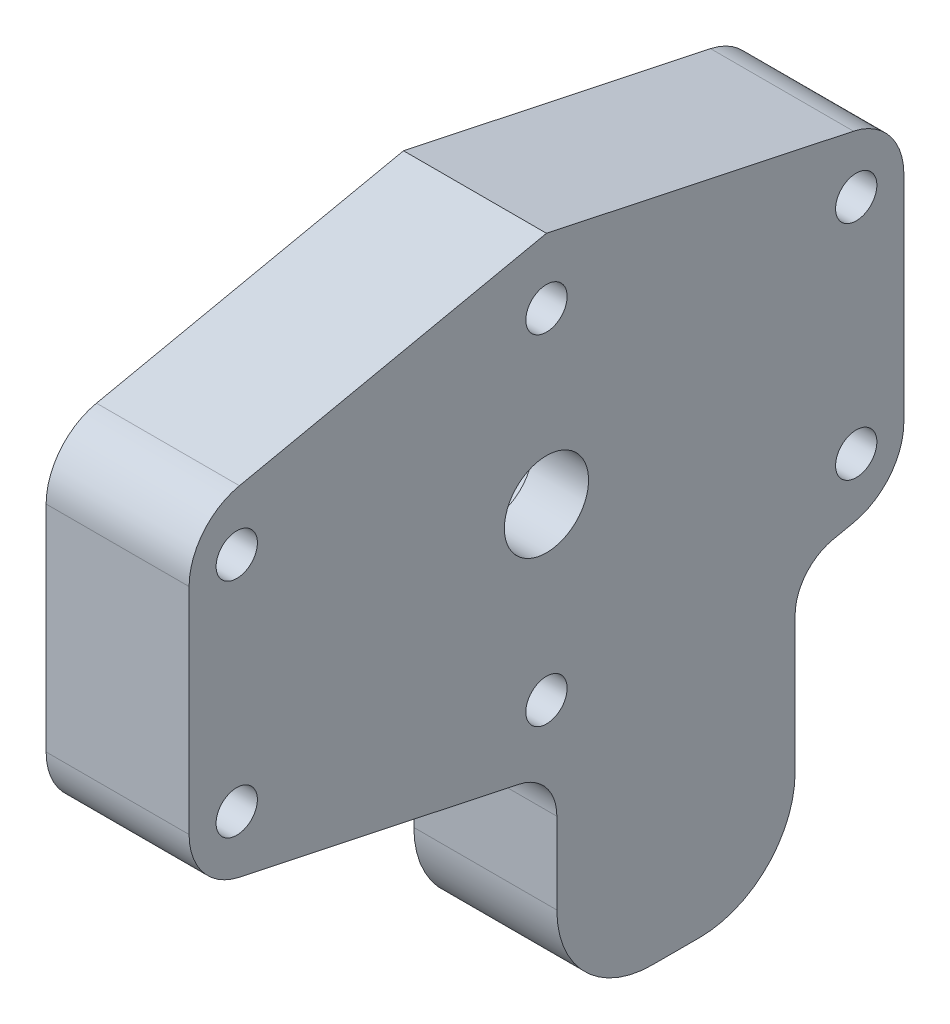
from build123d import *

# Parameters (mm, degrees)
SKETCH1_R           = 1.3
BOSS_EXTRUDE1_DEPTH = 9
CUT_REVOLVE3_ANGLE  = 180
SKETCH8_R           = 7.6
CUT_EXTRUDE4_DEPTH  = 5.5
SKETCH9_R           = 2.65
CUT_EXTRUDE5_DEPTH  = 52.660312042
BOSS_EXTRUDE7_DEPTH = 9
CUT_REVOLVE4_ANGLE  = 180
FILLET1_R           = 6
FILLET2_R           = 4
FILLET3_R           = 3
FILLET4_R           = 3


with BuildPart() as part:
    # Sketch1 → Boss-Extrude1 (new body)
    with BuildSketch(Plane(origin=(0, 0, 0), x_dir=(0, 0, -1), z_dir=(1, 0, 0))):
        Polygon((0, -20), (22.5, -24.769696007), (45, -20), (45, 0), (22.5, 4.769696007), (0, 0), align=None)
        with Locations((22.5, -20.680807118)):
            Circle(SKETCH1_R, mode=Mode.SUBTRACT)
        with Locations((22.5, 0.680807118)):
            Circle(SKETCH1_R, mode=Mode.SUBTRACT)
        with Locations((42, -17)):
            Circle(SKETCH1_R, mode=Mode.SUBTRACT)
        with Locations((3, -17)):
            Circle(SKETCH1_R, mode=Mode.SUBTRACT)
        with Locations((3, -3)):
            Circle(SKETCH1_R, mode=Mode.SUBTRACT)
        with Locations((42, -3)):
            Circle(SKETCH1_R, mode=Mode.SUBTRACT)
    extrude(amount=BOSS_EXTRUDE1_DEPTH)

    # Sketch7 → Cut-Revolve3 (revolve, cut)
    with BuildSketch(Plane.ZY):
        with BuildLine():
            Line((-41.7, -10), (-31.3, -10))
            ThreePointArc((-31.3, -10), (-36.5, -4.8), (-41.7, -10))
        make_face()
        with BuildLine():
            Line((-13.7, -10), (-3.3, -10))
            ThreePointArc((-3.3, -10), (-8.5, -4.8), (-13.7, -10))
        make_face()
    revolve(axis=Axis((0, -10, -41.7), (0, 0, -1)), revolution_arc=CUT_REVOLVE3_ANGLE, mode=Mode.SUBTRACT)

    # Sketch8 → Cut-Extrude4 (cut)
    with BuildSketch(Plane.ZY):
        with Locations((-22.5, -10)):
            Circle(SKETCH8_R)
    extrude(amount=-CUT_EXTRUDE4_DEPTH, mode=Mode.SUBTRACT)

    # Sketch9 → Cut-Extrude5 (cut, through all)
    with BuildSketch(Plane.ZY.offset(-5.5)):
        with Locations((-22.5, -10)):
            Circle(SKETCH9_R)
    extrude(amount=-CUT_EXTRUDE5_DEPTH, mode=Mode.SUBTRACT)

    # Sketch16 → Boss-Extrude7 (add)
    with BuildSketch(Plane(origin=(9, 0, 0), x_dir=(0, 0, -1), z_dir=(1, 0, 0))):
        Polygon((38.152173913, -21.451646611), (38.152173913, -38.451646611), (23.152173913, -38.451646611), (23.152173913, -24.631443949), align=None)
    extrude(amount=-BOSS_EXTRUDE7_DEPTH)

    # Sketch17 → Cut-Revolve4 (revolve, cut)
    with BuildSketch(Plane.ZY):
        with BuildLine():
            Line((-25.452173913, -30.451646611), (-35.852173913, -30.451646611))
            ThreePointArc((-35.852173913, -30.451646611), (-30.652173913, -25.251646611), (-25.452173913, -30.451646611))
        make_face()
    revolve(axis=Axis((0, -30.451646611, -25.452173913), (0, 0, -1)), revolution_arc=CUT_REVOLVE4_ANGLE, mode=Mode.SUBTRACT)

    # Fillet1
    fillet1_edges = [part.edges().sort_by_distance(p)[0] for p in [
        (4.5, -38.451646611, -38.152173913),
        (4.5, -38.451646611, -23.152173913),
    ]]
    fillet(fillet1_edges, radius=FILLET1_R)

    # Fillet2
    fillet2_edges = [part.edges().sort_by_distance(p)[0] for p in [
        (4.5, -20, -45),
        (4.5, -20, 0),
        (4.5, 0, 0),
        (4.5, 0, -45),
    ]]
    fillet(fillet2_edges, radius=FILLET2_R)

    # Fillet3
    # the kernel refuses this fillet: 3 mm, written as the material it adds along each edge
    with BuildSketch(Plane(origin=(9, -24.631443949, -23.152173913), x_dir=(0, -0.20737808726534282, 0.9782608695650501), z_dir=(-1, 0, 0))) as fillet3_piece_1:
        with BuildLine():
            CenterArc((3.350740319, -1.340055458), FILLET3_R, 153.468795145, 38.499950409)
            Line((0.41595771, -1.96218972), (0.357262058, -1.974632405))
            Line((0.357262058, -1.974632405), (-0.058695652, -0.012442685))
            Line((-0.058695652, -0.012442685), (0, 0.06))
            ThreePointArc((0, 0.06), (0.333333333, 0.06), (0.612985194, 0.026801109))
            Line((0.612985194, 0.026801109), (0.666666667, 0))
        make_face()
    extrude(amount=9)
    with BuildSketch(Plane(origin=(9, -21.451646611, -38.152173913), x_dir=(0, -1, 0), z_dir=(-1, 0, 0))) as fillet3_piece_2:
        with BuildLine():
            CenterArc((FILLET3_R * 0.810235733018, -FILLET3_R), FILLET3_R, 90, 78.031254445)
            Line((-FILLET3_R * 0.168025136547, -FILLET3_R * 0.792621912735), (-FILLET3_R * 0.187590353938, -FILLET3_R * 0.78847435099))
            Line((-FILLET3_R * 0.187590353938, -FILLET3_R * 0.78847435099), (-FILLET3_R * 0.0162047146604, FILLET3_R * 0.02))
            Line((-FILLET3_R * 0.0162047146604, FILLET3_R * 0.02), (FILLET3_R * 0.810235733018, FILLET3_R * 0.02))
            Line((FILLET3_R * 0.810235733018, FILLET3_R * 0.02), (FILLET3_R * 0.810235733018, 0))
        make_face()
    extrude(amount=9)

    # Fillet4
    fillet4_edges = [part.edges().sort_by_distance(p)[0] for p in [
        (4.5, -24.769696007, -22.5),
    ]]
    fillet(fillet4_edges, radius=FILLET4_R)


solid = part.part
